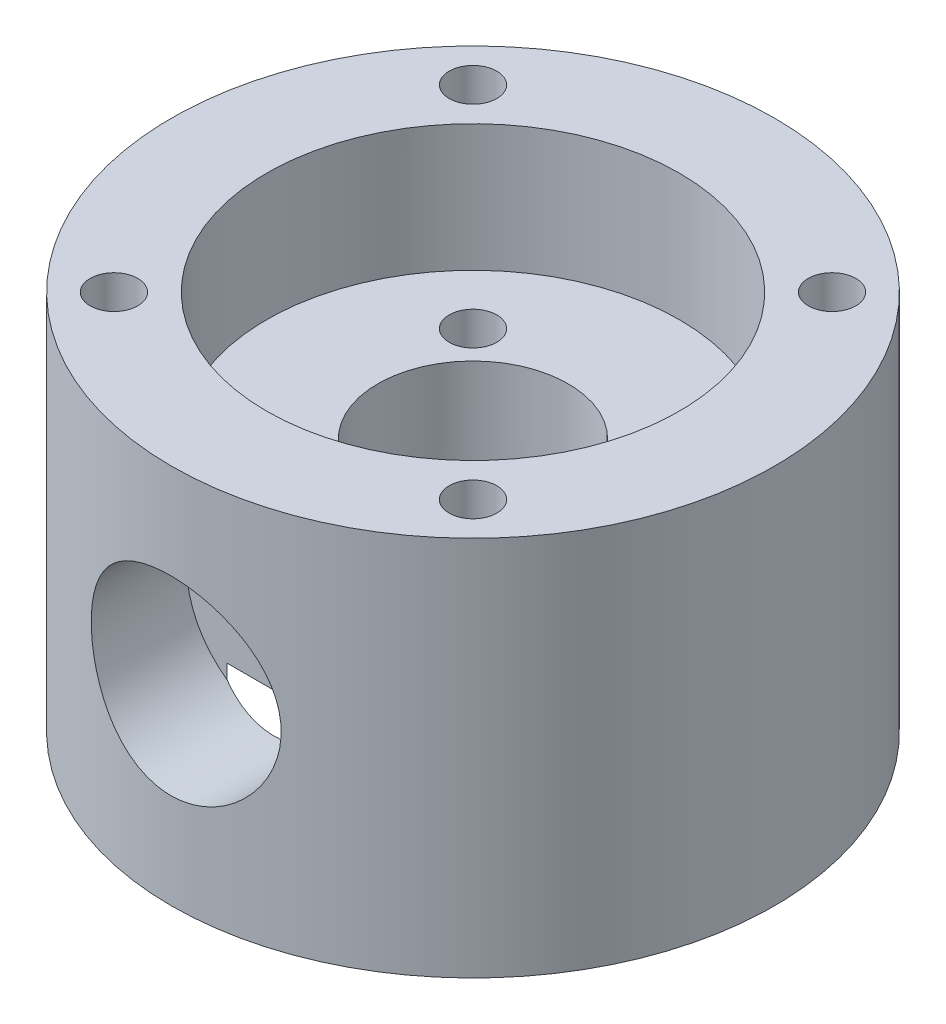
from build123d import *

# Parameters (mm, degrees)
SKETCH1_R              = 19
BOSS_EXTRUDE1_DEPTH    = 24
SKETCH2_R              = 13
CUT_EXTRUDE1_DEPTH     = 8
SKETCH3_R              = 6
CUT_EXTRUDE2_DEPTH     = 32.272991542
SKETCH4_R              = 12.5
CUT_EXTRUDE3_DEPTH     = 8
SKETCH5_W              = 22
SKETCH5_H              = 22
CUT_EXTRUDE4_DEPTH     = 8
CUT_EXTRUDE5_START     = 12
CUT_EXTRUDE5_OUTLINE_R = 6
CUT_EXTRUDE5_DEPTH     = 7.000000101
SKETCH6_R              = 1.5
CUT_EXTRUDE6_DEPTH     = 32.272991715
SKETCH7_R              = 1.5
CUT_EXTRUDE7_DEPTH     = 24


# Read off the part's stored shape, not the designer's step: Cut-Extrude5
with BuildPart() as part:
    # Sketch1 → Boss-Extrude1 (new body)
    with BuildSketch(Plane(origin=(0, 0, 0), x_dir=(1, 0, 0), z_dir=(0, 1, 0))):
        with Locations(Location((0, 0, 0), (0, 0, 270))):
            Circle(SKETCH1_R)
    extrude(amount=BOSS_EXTRUDE1_DEPTH)

    # Sketch2 → Cut-Extrude1 (cut)
    with BuildSketch(Plane(origin=(0, 24, 0), x_dir=(1, 0, 0), z_dir=(0, 1, 0))):
        with Locations(Location((0, 0, 0), (0, 0, 270))):
            Circle(SKETCH2_R)
    extrude(amount=-CUT_EXTRUDE1_DEPTH, mode=Mode.SUBTRACT)

    # Sketch3 → Cut-Extrude2 (cut, through all)
    with BuildSketch(Plane(origin=(0, 16, 0), x_dir=(1, 0, 0), z_dir=(0, 1, 0))):
        with Locations(Location((0, 0, 0), (0, 0, 270))):
            Circle(SKETCH3_R)
    extrude(amount=-CUT_EXTRUDE2_DEPTH, mode=Mode.SUBTRACT)

    # Sketch4 → Cut-Extrude3 (cut)
    with BuildSketch(Plane.XZ):
        with Locations(Location((0, 0, 0), (0, 0, 270))):
            Circle(SKETCH4_R)
    extrude(amount=-CUT_EXTRUDE3_DEPTH, mode=Mode.SUBTRACT)

    # Sketch5 → Cut-Extrude4 (cut)
    with BuildSketch(Plane.XZ):
        Rectangle(SKETCH5_W, SKETCH5_H)
    extrude(amount=-CUT_EXTRUDE4_DEPTH, mode=Mode.SUBTRACT)

    # Cut-Extrude5 outline → Cut-Extrude5 (cut)
    with BuildSketch(Plane.XY.offset(CUT_EXTRUDE5_START)):
        with Locations((-0.045844334, 12)):
            Circle(CUT_EXTRUDE5_OUTLINE_R)
    extrude(amount=CUT_EXTRUDE5_DEPTH, mode=Mode.SUBTRACT)

    # Sketch6 → Cut-Extrude6 (cut, through all)
    with BuildSketch(Plane(origin=(0, 16, 0), x_dir=(1, 0, 0), z_dir=(0, 1, 0))):
        with Locations(Location((-6.01040764, 6.01040764, 0), (0, 0, 270))):
            Circle(SKETCH6_R)
        with Locations(Location((6.01040764, -6.01040764, 0), (0, 0, 270))):
            Circle(SKETCH6_R)
    extrude(amount=-CUT_EXTRUDE6_DEPTH, mode=Mode.SUBTRACT)

    # Sketch7 → Cut-Extrude7 (cut)
    with BuildSketch(Plane(origin=(0, 24, 0), x_dir=(1, 0, 0), z_dir=(0, 1, 0))):
        with Locations(Location((11.313708499, -11.313708499, 0), (0, 0, 270))):
            Circle(SKETCH7_R)
        with Locations(Location((-11.313708499, -11.313708499, 0), (0, 0, 270))):
            Circle(SKETCH7_R)
        with Locations(Location((-11.313708499, 11.313708499, 0), (0, 0, 270))):
            Circle(SKETCH7_R)
        with Locations(Location((11.313708499, 11.313708499, 0), (0, 0, 270))):
            Circle(SKETCH7_R)
    extrude(amount=-CUT_EXTRUDE7_DEPTH, mode=Mode.SUBTRACT)


solid = part.part
